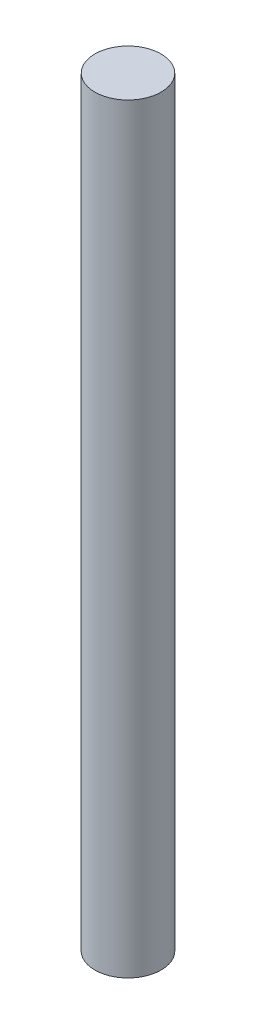
from build123d import *

# Parameters (mm, degrees)
SKETCH1_R           = 4
BOSS_EXTRUDE1_DEPTH = 45.95


with BuildPart() as part:
    # Sketch1 → Boss-Extrude1 (new, symmetric)
    with BuildSketch(Plane(origin=(0, 0, 0), x_dir=(1, 0, 0), z_dir=(0, 1, 0))):
        Circle(SKETCH1_R)
    extrude(amount=BOSS_EXTRUDE1_DEPTH, both=True)


solid = part.part
